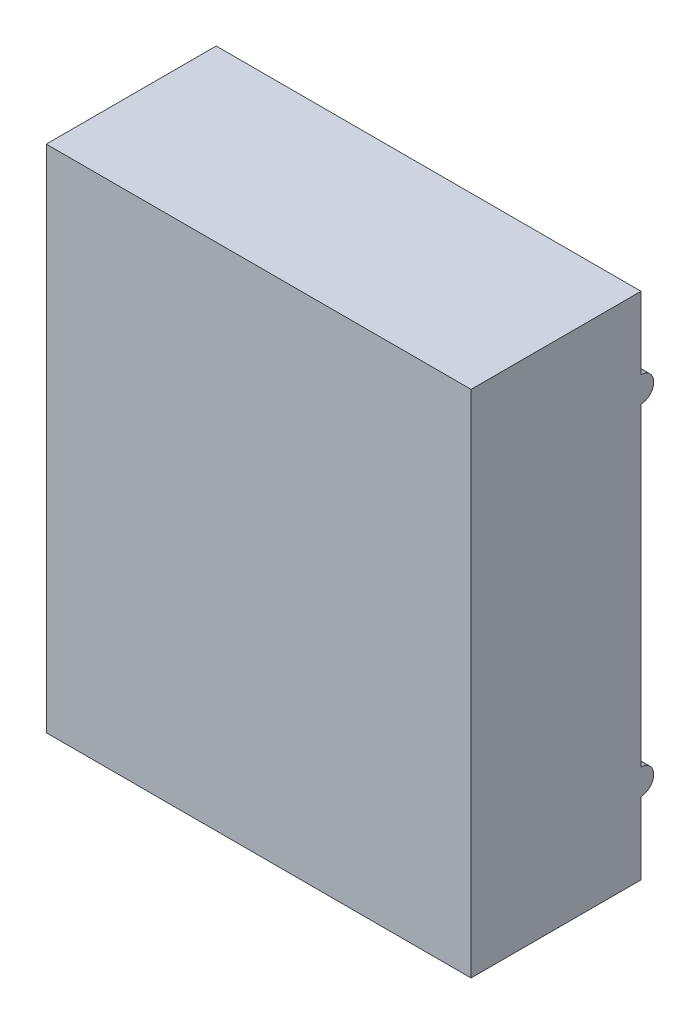
from build123d import *

# Parameters (mm, degrees)
SKETCH1_W           = 250
SKETCH1_H           = 300
BOSS_EXTRUDE1_DEPTH = 100
SKETCH2_W           = 15
SKETCH2_H           = 15
BOSS_EXTRUDE2_DEPTH = 7.5
FILLET1_R           = 7.5
SKETCH3_R           = 7.5
BOSS_EXTRUDE3_DEPTH = 10
BOSS_EXTRUDE4_START = -10
SKETCH4_R           = 7.5
BOSS_EXTRUDE4_DEPTH = 10


with BuildPart() as part:
    # Sketch1 → Boss-Extrude1 (new body)
    with BuildSketch(Plane.XY):
        Rectangle(SKETCH1_W, SKETCH1_H)
    extrude(amount=BOSS_EXTRUDE1_DEPTH)

    # Sketch2 → Boss-Extrude2 (add)
    with BuildSketch(Plane(origin=(0, 0, 0), x_dir=(-1, 0, 0), z_dir=(0, 0, -1))):
        with Locations((0, 100)):
            Rectangle(SKETCH2_W, SKETCH2_H)
        with Locations((0, -100)):
            Rectangle(SKETCH2_W, SKETCH2_H)
    extrude(amount=BOSS_EXTRUDE2_DEPTH)

    # Fillet1
    fillet1_edges = [part.edges().sort_by_distance(p)[0] for p in [
        (0, 107.5, -7.5),
        (0, 92.5, -7.5),
        (0, -107.5, -7.5),
        (0, -92.5, -7.5),
    ]]
    fillet(fillet1_edges, radius=FILLET1_R - 0.0001)  # a hair under: the kernel refuses the full size

    # Sketch3 → Boss-Extrude3 (add)
    with BuildSketch(Plane.ZY.offset(125)):
        with Locations((0, 100)):
            Circle(SKETCH3_R)
        with Locations((0, -100)):
            Circle(SKETCH3_R)
    extrude(amount=-BOSS_EXTRUDE3_DEPTH)

    # Sketch4 → Boss-Extrude4 (add)
    with BuildSketch(Plane(origin=(125, 0, 0), x_dir=(0, 0, -1), z_dir=(1, 0, 0)).offset(BOSS_EXTRUDE4_START)):
        with Locations((0, 100)):
            Circle(SKETCH4_R)
        with Locations((0, -100)):
            Circle(SKETCH4_R)
    extrude(amount=BOSS_EXTRUDE4_DEPTH)


solid = part.part
